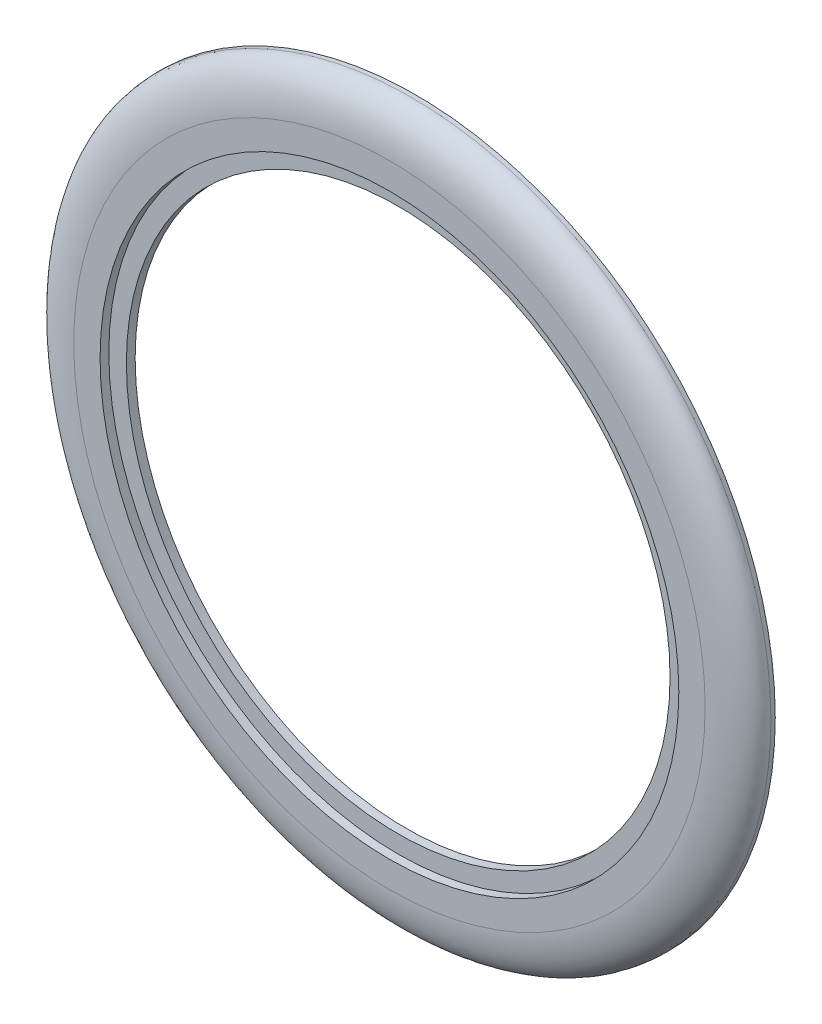
from build123d import *

# Parameters (mm, degrees)
SKETCH1_R           = 20.5
BOSS_EXTRUDE1_DEPTH = 1.5
FILLET1_SIZE        = 1.25
FILLET1_SIZE_2      = 2.5
SKETCH2_R           = 16.5
CUT_EXTRUDE1_DEPTH  = 0.5
SKETCH3_R           = 15.5
CUT_EXTRUDE2_DEPTH  = 30.00861955
SKETCH4_R           = 18
CUT_EXTRUDE3_DEPTH  = 0.5


with BuildPart() as part:
    # Sketch1 → Boss-Extrude1 (new body)
    with BuildSketch(Plane.XY):
        Circle(SKETCH1_R)
    extrude(amount=BOSS_EXTRUDE1_DEPTH)

    # Fillet1
    # an asymmetric fillet: 2.5, 1.25 mm, written as the material it takes off along each edge
    with BuildSketch(Plane(origin=(0, 0, 1.5), x_dir=(1, 0, 0), z_dir=(0, -1, 0))) as fillet1_piece_1:
        with BuildLine():
            Bezier((20.5, -FILLET1_SIZE), (20.5, 0), (20.5 - FILLET1_SIZE_2, 0), weights=[1, 0.707106781, 1])
            Line((20.5 - FILLET1_SIZE_2, 0), (20.5, 0))
            Line((20.5, 0), (20.5, -FILLET1_SIZE))
        make_face()
    revolve(axis=Axis((0, 0, 1.5), (0, 0, 1)), mode=Mode.SUBTRACT)

    # Sketch2 → Cut-Extrude1 (cut)
    with BuildSketch(Plane.XY.offset(1.5)):
        Circle(SKETCH2_R)
    extrude(amount=-CUT_EXTRUDE1_DEPTH, mode=Mode.SUBTRACT)

    # Sketch3 → Cut-Extrude2 (cut, through all)
    with BuildSketch(Plane.XY.offset(1)):
        Circle(SKETCH3_R)
    extrude(amount=-CUT_EXTRUDE2_DEPTH, mode=Mode.SUBTRACT)

    # Sketch4 → Cut-Extrude3 (cut)
    with BuildSketch(Plane(origin=(0, 0, 0), x_dir=(-1, 0, 0), z_dir=(0, 0, -1))):
        Circle(SKETCH4_R)
    extrude(amount=-CUT_EXTRUDE3_DEPTH, mode=Mode.SUBTRACT)


solid = part.part
